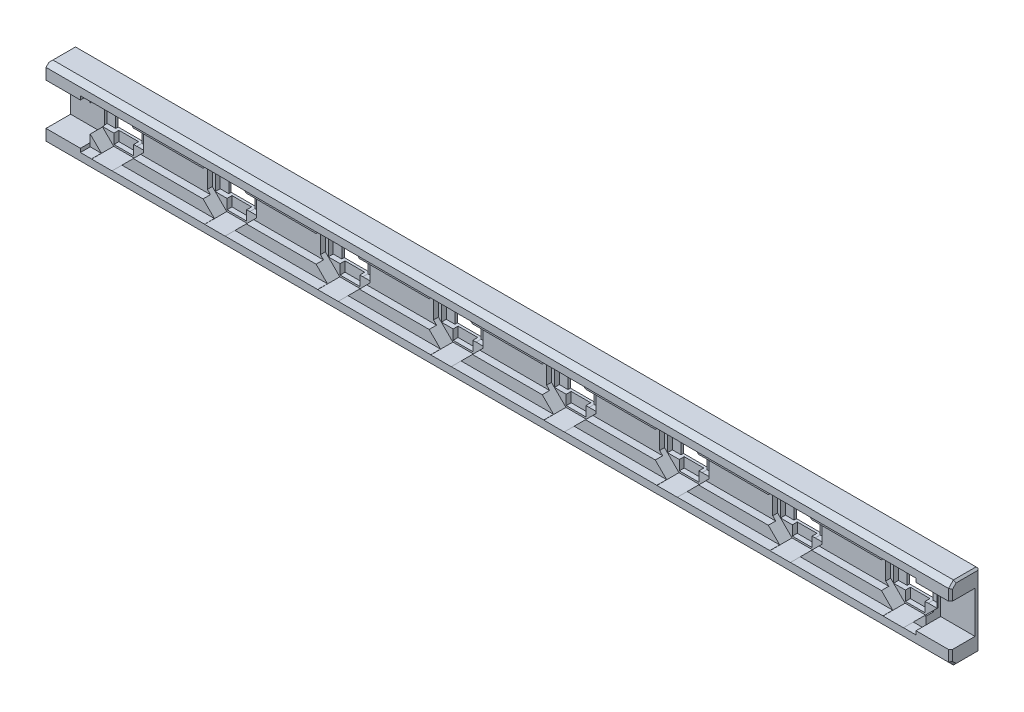
from build123d import *

# Parameters (mm, degrees)
SKETCH1_W                = 184
SKETCH1_H                = 15
BOSS_EXTRUDE1_DEPTH      = 6
CUT_EXTRUDE8_DEPTH       = 184
SKETCH13_W               = 0.5
SKETCH13_H               = 10
CUT_EXTRUDE9_DEPTH       = 0.6
FILLET1_R                = 0.25
FILLET2_R                = 0.25
CHAMFER1_SIZE            = 0.4
CHAMFER2_SIZE            = 0.4
CHAMFER3_SIZE            = 0.4
CHAMFER5_SIZE            = 0.4
CUT_EXTRUDE10_DEPTH      = 4.5
SKETCH16_W               = 5.3
SKETCH16_H               = 5.3
CUT_EXTRUDE11_DEPTH      = 4.5
SKETCH17_W               = 4
SKETCH17_H               = 2
CUT_EXTRUDE12_DEPTH      = 1
SKETCH18_W               = 1.75
SKETCH18_H               = 5.318073247
SKETCH18_H_2             = 5.281926753
CUT_EXTRUDE13_DEPTH      = 1
LPATTERN1_COUNT          = 8
LPATTERN1_PITCH          = 23
SKETCH19_W               = 7
SKETCH19_H               = 8.5
CUT_EXTRUDE14_DEPTH      = 5
SKETCH20_W               = 170
SKETCH20_H               = 10
CUT_EXTRUDE15_DEPTH      = 2
CUT_EXTRUDE16_DEPTH      = 112.8161514
CUT_EXTRUDE16_DEPTH_BACK = 112.8161514
SKETCH21_W               = 1.5
SKETCH21_H               = 5.392715996


with BuildPart() as part:
    # Sketch1 → Boss-Extrude1 (new body)
    with BuildSketch(Plane.XY):
        with Locations((-45.75, 18.154296875)):
            Rectangle(SKETCH1_W, SKETCH1_H)
    extrude(amount=BOSS_EXTRUDE1_DEPTH)

    # Sketch12 → Cut-Extrude8 (cut)
    with BuildSketch(Plane(origin=(46.25, 0, 0), x_dir=(0, 0, -1), z_dir=(1, 0, 0))):
        Polygon((-6, 25.654296875), (-6, 24.654296875), (-5, 25.654296875), align=None)
        Polygon((-6, 10.654296875), (-5, 10.654296875), (-6, 11.654296875), align=None)
    extrude(amount=-CUT_EXTRUDE8_DEPTH, mode=Mode.SUBTRACT)

    # Sketch13 → Cut-Extrude9 (cut)
    with BuildSketch(Plane(origin=(0, 0, 0), x_dir=(-1, 0, 0), z_dir=(0, 0, -1))):
        with Locations((135.5, 18.154296875)):
            Rectangle(SKETCH13_W, SKETCH13_H)
    extrude(amount=-CUT_EXTRUDE9_DEPTH, mode=Mode.SUBTRACT)

    # Fillet1
    fillet1_edges = [part.edges().sort_by_distance(p)[0] for p in [
        (-135.75, 18.154296875, 0),
    ]]
    fillet(fillet1_edges, radius=FILLET1_R)

    # Fillet2
    fillet2_edges = [part.edges().sort_by_distance(p)[0] for p in [
        (-135.25, 18.154296875, 0.6),
        (-135.5, 23.154296875, 0.6),
        (-135.75, 18.154296875, 0.6),
        (-135.5, 13.154296875, 0.6),
    ]]
    fillet(fillet2_edges, radius=FILLET2_R - 0.0001)  # a hair under: the kernel refuses the full size

    # Chamfer1
    chamfer1_edges = [part.edges().sort_by_distance(p)[0] for p in [
        (-45.75, 25.654296875, 0),
        (-45.75, 10.654296875, 0),
    ]]
    chamfer(chamfer1_edges, length=CHAMFER1_SIZE)

    # Chamfer2
    chamfer2_edges = [part.edges().sort_by_distance(p)[0] for p in [
        (46.25, 18.154296875, 0),
        (-137.75, 18.154296875, 0),
    ]]
    chamfer(chamfer2_edges, length=CHAMFER2_SIZE)

    # Chamfer3
    chamfer3_edges = [part.edges().sort_by_distance(p)[0] for p in [
        (-137.75, 25.654296875, 2.7),
        (-137.75, 10.654296875, 2.7),
    ]]
    chamfer(chamfer3_edges, length=CHAMFER3_SIZE)

    # Chamfer5
    chamfer5_edges = [part.edges().sort_by_distance(p)[0] for p in [
        (46.25, 18.154296875, 6),
        (46.25, 25.654296875, 2.7),
        (46.25, 10.654296875, 2.7),
        (46.25, 25.154296875, 5.5),
        (46.25, 11.154296875, 5.5),
    ]]
    chamfer(chamfer5_edges, length=CHAMFER5_SIZE)

    # Sketch15 → Cut-Extrude10 (cut)
    with BuildSketch(Plane.XY.offset(6)):
        Polygon((-121.382117138, 20.232772011), (-124.321524864, 23.172179737), (-128.478475136, 23.172179737), (-131.417882862, 20.232772011), (-131.417882862, 16.075821739), (-128.478475136, 13.136414013), (-124.321524864, 13.136414013), (-121.382117138, 16.075821739), align=None)
    cut_extrude10 = extrude(amount=-CUT_EXTRUDE10_DEPTH, mode=Mode.SUBTRACT)

    # Sketch16 → Cut-Extrude11 (cut)
    with BuildSketch(Plane.XY.offset(1.5)):
        with Locations((-126.417882862, 18.136414013)):
            Rectangle(SKETCH16_W, SKETCH16_H)
    cut_extrude11 = extrude(amount=-CUT_EXTRUDE11_DEPTH, mode=Mode.SUBTRACT)

    # Sketch17 → Cut-Extrude12 (cut)
    with BuildSketch(Plane.XY.offset(1.5)):
        with Locations((-126.417882862, 14.486414013)):
            Rectangle(SKETCH17_W, SKETCH17_H)
        with Locations((-126.417882862, 21.786414013)):
            Rectangle(SKETCH17_W, SKETCH17_H)
    cut_extrude12 = extrude(amount=-CUT_EXTRUDE12_DEPTH, mode=Mode.SUBTRACT)

    # Sketch18 → Cut-Extrude13 (cut)
    with BuildSketch(Plane.XY.offset(1.5)):
        with Locations((-129.942882862, 18.145450637)):
            Rectangle(SKETCH18_W, SKETCH18_H)
        with Locations((-122.892882862, 18.145450637)):
            Rectangle(SKETCH18_W, SKETCH18_H_2)
    cut_extrude13 = extrude(amount=-CUT_EXTRUDE13_DEPTH, mode=Mode.SUBTRACT)

    # LPattern1: Cut-Extrude10, Cut-Extrude11, Cut-Extrude12, Cut-Extrude13 ×8
    with Locations(*[(i * LPATTERN1_PITCH, 0, 0) for i in range(1, LPATTERN1_COUNT)]):
        add(cut_extrude10, mode=Mode.SUBTRACT)
        add(cut_extrude11, mode=Mode.SUBTRACT)
        add(cut_extrude12, mode=Mode.SUBTRACT)
        add(cut_extrude13, mode=Mode.SUBTRACT)

    # Sketch19 → Cut-Extrude14 (cut)
    with BuildSketch(Plane.XY.offset(6)):
        with Locations((-134.25, 18.154296875)):
            Rectangle(SKETCH19_W, SKETCH19_H)
        with Locations((42.75, 18.154296875)):
            Rectangle(SKETCH19_W, SKETCH19_H)
    extrude(amount=-CUT_EXTRUDE14_DEPTH, mode=Mode.SUBTRACT)

    # Sketch20 → Cut-Extrude15 (cut)
    with BuildSketch(Plane.XY.offset(6)):
        with Locations((-45.75, 18.154296875)):
            Rectangle(SKETCH20_W, SKETCH20_H)
    extrude(amount=-CUT_EXTRUDE15_DEPTH, mode=Mode.SUBTRACT)

    # Sketch21 → Cut-Extrude16 (cut, two sides: drawn at the far end of the back side and taken through both)
    with BuildSketch(Plane(origin=(-62.417882862, 0, 0), x_dir=(0, 0, -1), z_dir=(1, 0, 0)).offset(-CUT_EXTRUDE16_DEPTH_BACK)):
        with Locations((-3.25, 18.154296875)):
            Rectangle(SKETCH21_W, SKETCH21_H)
    extrude(amount=CUT_EXTRUDE16_DEPTH + CUT_EXTRUDE16_DEPTH_BACK, mode=Mode.SUBTRACT)


solid = part.part
